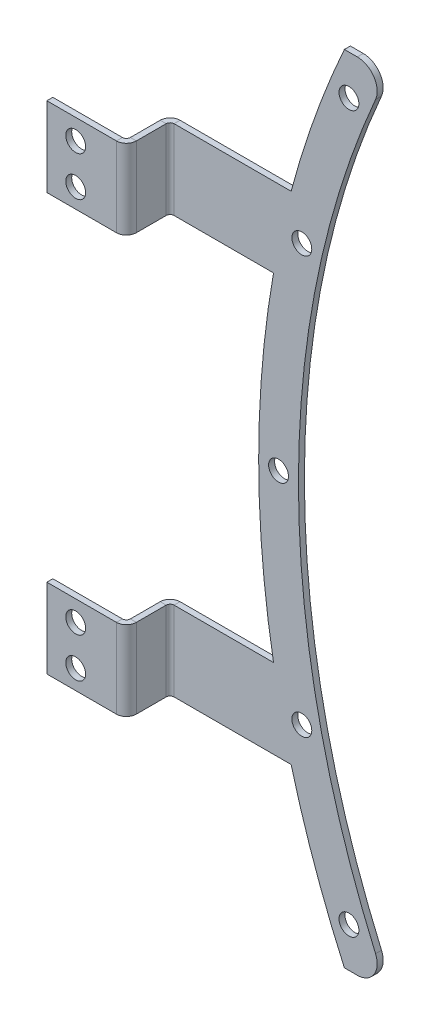
from build123d import *

# Parameters (mm, degrees)
SKETCH1_R                = 2.5
BOSS_EXTRUDE1_DEPTH      = 4
CONVERT_SOLID1_OUTLINE_R = 2.5
CONVERT_SOLID1_DEPTH     = 2.5
EDGE_FLANGE1_DEPTH       = 20
EDGE_FLANGE1_BEND_DEPTH  = 20
EDGE_FLANGE2_DEPTH       = 20
EDGE_FLANGE2_BEND_DEPTH  = 20
SKETCH14_R               = 2.5
CUT_EXTRUDE1_DEPTH       = 4


# Read off the part's stored shape, not the designer's step: Convert-Solid1
# Sheet-metal steps are written as plain solids
with BuildPart() as part:
    # Sketch1 → Boss-Extrude1 (new body)
    with BuildSketch(Plane.XY):
        with BuildLine():
            Line((-474.195090562, 127.525252525), (-477.445756062, 127.525252525))
            ThreePointArc((-477.445756062, 127.525252525), (-484.91471638, 109.01150893), (-490.83715139, 89.946650322))
            Line((-490.83715139, 89.946650322), (-520.264617773, 89.946650322))
            Line((-520.264617773, 89.946650322), (-520.264617773, 69.946650322))
            Line((-520.264617773, 69.946650322), (-495.264617773, 69.946650322))
            ThreePointArc((-495.264617773, 69.946650322), (-499, 27.525252525), (-495.264617773, -14.896145272))
            Line((-495.264617773, -14.896145272), (-520.264617773, -14.896145272))
            Line((-520.264617773, -14.896145272), (-520.264617773, -34.896145272))
            Line((-520.264617773, -34.896145272), (-490.83715139, -34.896145272))
            ThreePointArc((-490.83715139, -34.896145272), (-484.91471638, -53.961003879), (-477.445756062, -72.474747475))
            Line((-477.445756062, -72.474747475), (-474.195090562, -72.474747475))
            ThreePointArc((-474.195090562, -72.474747475), (-470.012418883, -70.21432), (-469.611597595, -65.476850524))
            ThreePointArc((-469.611597595, -65.476850524), (-489, 27.525252525), (-469.611597595, 120.527355575))
            ThreePointArc((-469.611597595, 120.527355575), (-470.012418883, 125.264825051), (-474.195090562, 127.525252525))
        make_face()
        with Locations(Location((-488.148813177, 79.946650322, 0), (0, 0, 180))):
            Circle(SKETCH1_R, mode=Mode.SUBTRACT)
        with Locations((-494, 27.525252525)):
            Circle(SKETCH1_R, mode=Mode.SUBTRACT)
        with Locations((-488.148813177, -24.896145272)):
            Circle(SKETCH1_R, mode=Mode.SUBTRACT)
        with Locations((-476.297445473, -62.474747475)):
            Circle(SKETCH1_R, mode=Mode.SUBTRACT)
        with Locations(Location((-476.297445473, 117.525252525, 0), (0, 0, 180))):
            Circle(SKETCH1_R, mode=Mode.SUBTRACT)
    extrude(amount=BOSS_EXTRUDE1_DEPTH)

    # Convert-Solid1 outline → Convert-Solid1 (cut)
    with BuildSketch(Plane.XY):
        with BuildLine():
            ThreePointArc((-490.83715139, -34.896145272), (-484.91471638, -53.961003879), (-477.445756062, -72.474747475))
            Line((-477.445756062, -72.474747475), (-474.195090562, -72.474747475))
            ThreePointArc((-474.195090562, -72.474747475), (-470.012418883, -70.21432), (-469.611597595, -65.476850524))
            ThreePointArc((-469.611597595, -65.476850524), (-489, 27.525252525), (-469.611597595, 120.527355575))
            ThreePointArc((-469.611597595, 120.527355575), (-470.012418883, 125.264825051), (-474.195090562, 127.525252525))
            Line((-474.195090562, 127.525252525), (-477.445756062, 127.525252525))
            ThreePointArc((-477.445756062, 127.525252525), (-484.91471638, 109.011508929), (-490.83715139, 89.946650322))
            Line((-490.83715139, 89.946650322), (-520.264617773, 89.946650322))
            Line((-520.264617773, 89.946650322), (-520.264617773, 69.946650322))
            Line((-520.264617773, 69.946650322), (-495.264617773, 69.946650322))
            ThreePointArc((-495.264617773, 69.946650322), (-499, 27.525252525), (-495.264617773, -14.896145272))
            Line((-495.264617773, -14.896145272), (-520.264617773, -14.896145272))
            Line((-520.264617773, -14.896145272), (-520.264617773, -34.896145272))
            Line((-520.264617773, -34.896145272), (-490.83715139, -34.896145272))
        make_face()
        with Locations((-488.148813177, -24.896145272)):
            Circle(CONVERT_SOLID1_OUTLINE_R, mode=Mode.SUBTRACT)
        with Locations((-476.297445473, -62.474747475)):
            Circle(CONVERT_SOLID1_OUTLINE_R, mode=Mode.SUBTRACT)
        with Locations((-494, 27.525252525)):
            Circle(CONVERT_SOLID1_OUTLINE_R, mode=Mode.SUBTRACT)
        with Locations((-488.148813177, 79.946650322)):
            Circle(CONVERT_SOLID1_OUTLINE_R, mode=Mode.SUBTRACT)
        with Locations((-476.297445473, 117.525252525)):
            Circle(CONVERT_SOLID1_OUTLINE_R, mode=Mode.SUBTRACT)
    extrude(amount=CONVERT_SOLID1_DEPTH, mode=Mode.SUBTRACT)

    # Edge-Flange1 section (across the edge) → Edge-Flange1 (add)
    with BuildSketch(Plane(origin=(-521.264617773, 89.946650322, 4), x_dir=(1, 0, 0), z_dir=(0, -1, 0))):
        with BuildLine():
            Line((-1.5, 1), (-1.5, 8.5))
            Line((-1.5, 8.5), (0, 8.5))
            Line((0, 8.5), (0, 1))
            ThreePointArc((0, 1), (0.292893219, 0.292893219), (1, 0))
            Line((1, 0), (1, -1.5))
            ThreePointArc((1, -1.5), (-0.767766953, -0.767766953), (-1.5, 1))
        make_face()
    extrude(amount=EDGE_FLANGE1_DEPTH)

    # Edge-Flange1 section 2 (across the edge) → Edge-Flange1 bend (add)
    with BuildSketch(Plane(origin=(-521.264617773, -14.896145272, 4), x_dir=(1, 0, 0), z_dir=(0, -1, 0))):
        with BuildLine():
            Line((-1.5, 1), (-1.5, 8.5))
            Line((-1.5, 8.5), (0, 8.5))
            Line((0, 8.5), (0, 1))
            ThreePointArc((0, 1), (0.292893219, 0.292893219), (1, 0))
            Line((1, 0), (1, -1.5))
            ThreePointArc((1, -1.5), (-0.767766953, -0.767766953), (-1.5, 1))
        make_face()
    extrude(amount=EDGE_FLANGE1_BEND_DEPTH)

    # Edge-Flange2 section (across the edge) → Edge-Flange2 (add)
    with BuildSketch(Plane(origin=(-522.764617773, 69.946650322, 13.5), x_dir=(0, 0, -1), z_dir=(0, 1, 0))):
        with BuildLine():
            Line((-1.5, 1), (-1.5, 18.5))
            Line((-1.5, 18.5), (0, 18.5))
            Line((0, 18.5), (0, 1))
            ThreePointArc((0, 1), (0.292893219, 0.292893219), (1, 0))
            Line((1, 0), (1, -1.5))
            ThreePointArc((1, -1.5), (-0.767766953, -0.767766953), (-1.5, 1))
        make_face()
    extrude(amount=EDGE_FLANGE2_DEPTH)

    # Edge-Flange2 section 2 (across the edge) → Edge-Flange2 bend (add)
    with BuildSketch(Plane(origin=(-522.764617773, -34.896145272, 13.5), x_dir=(0, 0, -1), z_dir=(0, 1, 0))):
        with BuildLine():
            Line((-1.5, 1), (-1.5, 18.5))
            Line((-1.5, 18.5), (0, 18.5))
            Line((0, 18.5), (0, 1))
            ThreePointArc((0, 1), (0.292893219, 0.292893219), (1, 0))
            Line((1, 0), (1, -1.5))
            ThreePointArc((1, -1.5), (-0.767766953, -0.767766953), (-1.5, 1))
        make_face()
    extrude(amount=EDGE_FLANGE2_BEND_DEPTH)

    # Sketch14 → Cut-Extrude1 (cut)
    with BuildSketch(Plane.XY.offset(15)):
        with Locations((-534.014617773, 74.799905576)):
            Circle(SKETCH14_R)
        with Locations((-534.014617773, -20.042890014)):
            Circle(SKETCH14_R)
        with Locations((-534.014617773, -30.042890014)):
            Circle(SKETCH14_R)
        with Locations((-534.014617773, 84.799905576)):
            Circle(SKETCH14_R)
    extrude(amount=-CUT_EXTRUDE1_DEPTH, mode=Mode.SUBTRACT)


solid = part.part
